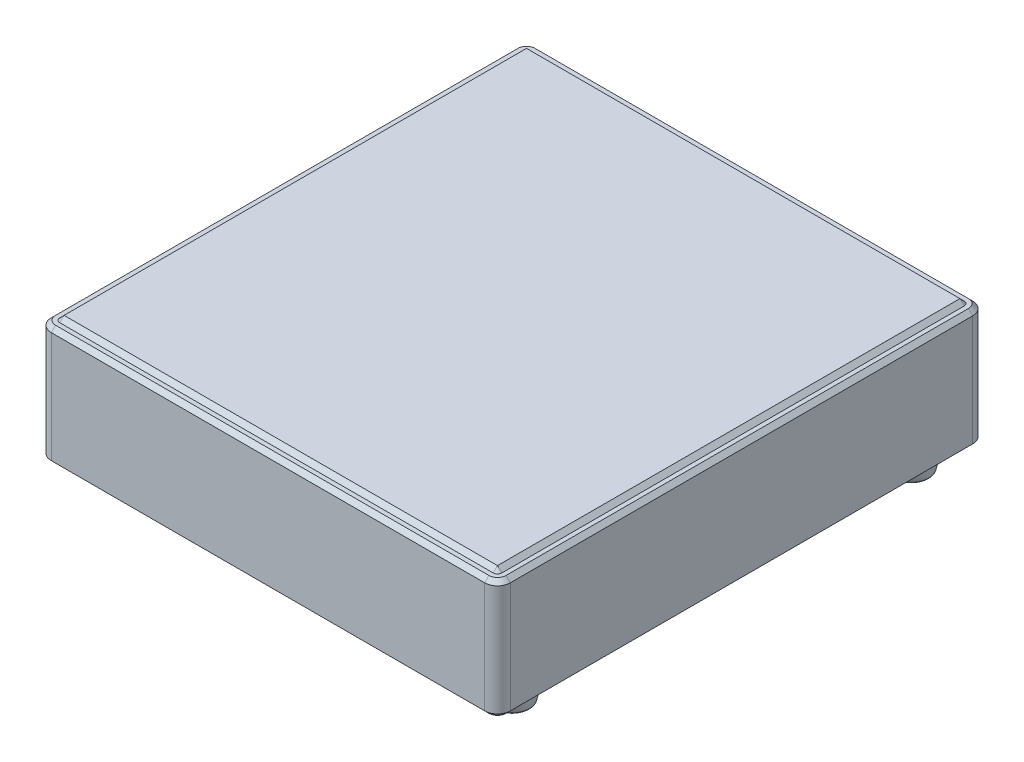
from build123d import *

# Parameters (mm, degrees)
SKETCH1_W                    = 107.6
SKETCH1_H                    = 114.4
BOSS_EXTRUDE1_DEPTH          = 30
SKETCH2_R                    = 1.5
CUT_EXTRUDE1_DEPTH           = 10
SKETCH3_R                    = 4.5
SKETCH3_R_2                  = 2.75
BOSS_EXTRUDE2_DEPTH          = 3
FILLET5_R                    = 0.5
FILLET5_OF_SKETCH_PATTERN1_R = 0.5
FILLET2_R                    = 3
SKETCH6_OUTSIDE_W            = 141.696
SKETCH6_OUTSIDE_H            = 148.496
CUT_EXTRUDE2_DEPTH           = 1
SKETCH7_OUTSIDE_W            = 141.696
SKETCH7_OUTSIDE_H            = 148.496
CUT_EXTRUDE3_DEPTH           = 1
CHAMFER1_SIZE                = 1
CHAMFER2_SIZE                = 1
FILLET4_R                    = 0.5


with BuildPart() as part:
    # Sketch1 → Boss-Extrude1 (new body)
    with BuildSketch(Plane(origin=(0, 0, 0), x_dir=(1, 0, 0), z_dir=(0, 1, 0))):
        with Locations((53.8, 57.2)):
            Rectangle(SKETCH1_W, SKETCH1_H)
    extrude(amount=BOSS_EXTRUDE1_DEPTH)

    # Sketch2 → Cut-Extrude1 (cut)
    with BuildSketch(Plane.XZ):
        with Locations(Location((7, -104, 0), (0, 0, 270))):
            Circle(SKETCH2_R)
        with Locations(Location((100.6, -104, 0), (0, 0, 270))):
            Circle(SKETCH2_R)
        with Locations(Location((100.6, -10.4, 0), (0, 0, 270))):
            Circle(SKETCH2_R)
        with Locations(Location((7, -10.4, 0), (0, 0, 270))):
            Circle(SKETCH2_R)
        with Locations(Location((53.8, -17.2, 0), (0, 0, 270))):
            Circle(SKETCH2_R)
        with Locations(Location((53.8, -97.2, 0), (0, 0, 270))):
            Circle(SKETCH2_R)
    extrude(amount=-CUT_EXTRUDE1_DEPTH, mode=Mode.SUBTRACT)

    # Sketch3 → Boss-Extrude2 (add)
    with BuildSketch(Plane.XZ):
        with Locations(Location((7, -104, 0), (0, 0, 270))):
            Circle(SKETCH3_R)
        with Locations(Location((7, -104, 0), (0, 0, 270))):
            Circle(SKETCH3_R_2, mode=Mode.SUBTRACT)
    boss_extrude2 = extrude(amount=BOSS_EXTRUDE2_DEPTH)

    # Sketch8 → Cut-Revolve1 (revolve, cut)
    with BuildSketch(Plane(origin=(7, 0, 0), x_dir=(0, 0, -1), z_dir=(1, 0, 0))):
        with BuildLine():
            Line((108.5, 0), (108.5, -3))
            Line((108.5, -3), (108, -3))
            ThreePointArc((108, -3), (108.374143795, -1.520690633), (108.5, 0))
        make_face()
    cut_revolve1 = revolve(axis=Axis((7, -3, -104), (0, 1, 0)), mode=Mode.SUBTRACT)

    # Fillet5
    fillet5_edges = [part.edges().sort_by_distance(p)[0] for p in [
        (7, -3, -100),
    ]]
    fillet(fillet5_edges, radius=FILLET5_R)

    # Sketch-Pattern1: Boss-Extrude2, Cut-Revolve1 at 3 more places
    with Locations((0, 0, 93.6), (93.6, 0, 93.6), (93.6, 0, 0)):
        add(boss_extrude2)
        add(cut_revolve1, mode=Mode.SUBTRACT)

    # Fillet5 of Sketch-Pattern1
    fillet5_of_sketch_pattern1_edges = [part.edges().sort_by_distance(p)[0] for p in [
        (7, -3, -6.4),
        (100.6, -3, -6.4),
        (100.6, -3, -100),
    ]]
    fillet(fillet5_of_sketch_pattern1_edges, radius=FILLET5_OF_SKETCH_PATTERN1_R)

    # Fillet2
    fillet2_edges = [part.edges().sort_by_distance(p)[0] for p in [
        (0, 15, -114.4),
        (107.6, 15, -114.4),
        (107.6, 15, 0),
        (0, 15, 0),
    ]]
    fillet(fillet2_edges, radius=FILLET2_R)

    # Sketch6 outside → Cut-Extrude2 (cut)
    with BuildSketch(Plane(origin=(0, 30, 0), x_dir=(1, 0, 0), z_dir=(0, 1, 0))):
        with Locations((53.8, 57.2)):
            Rectangle(SKETCH6_OUTSIDE_W, SKETCH6_OUTSIDE_H)
        with BuildLine():
            Line((2, 111.4), (2, 3))
            ThreePointArc((2, 3), (2.292893219, 2.292893219), (3, 2))
            Line((3, 2), (104.6, 2))
            ThreePointArc((104.6, 2), (105.307106781, 2.292893219), (105.6, 3))
            Line((105.6, 3), (105.6, 111.4))
            ThreePointArc((105.6, 111.4), (105.307106781, 112.107106781), (104.6, 112.4))
            Line((104.6, 112.4), (3, 112.4))
            ThreePointArc((3, 112.4), (2.292893219, 112.107106781), (2, 111.4))
        make_face(mode=Mode.SUBTRACT)
    extrude(amount=-CUT_EXTRUDE2_DEPTH, mode=Mode.SUBTRACT)

    # Sketch7 outside → Cut-Extrude3 (cut)
    with BuildSketch(Plane.XZ):
        with Locations((53.8, -57.2)):
            Rectangle(SKETCH7_OUTSIDE_W, SKETCH7_OUTSIDE_H)
        with BuildLine():
            Line((105.6, -111.4), (105.6, -3))
            ThreePointArc((105.6, -3), (105.307106781, -2.292893219), (104.6, -2))
            Line((104.6, -2), (3, -2))
            ThreePointArc((3, -2), (2.292893219, -2.292893219), (2, -3))
            Line((2, -3), (2, -111.4))
            ThreePointArc((2, -111.4), (2.292893219, -112.107106781), (3, -112.4))
            Line((3, -112.4), (104.6, -112.4))
            ThreePointArc((104.6, -112.4), (105.307106781, -112.107106781), (105.6, -111.4))
        make_face(mode=Mode.SUBTRACT)
    extrude(amount=-CUT_EXTRUDE3_DEPTH, mode=Mode.SUBTRACT)

    # Chamfer1
    chamfer1_edges = [part.edges().sort_by_distance(p)[0] for p in [
        (0.878679656, 29, -0.878679656),
        (53.8, 29, -114.4),
        (0, 29, -57.2),
        (53.8, 29, 0),
        (107.6, 29, -57.2),
        (106.721320344, 29, -113.521320344),
        (106.721320344, 29, -0.878679656),
        (0.878679656, 29, -113.521320344),
        (0.878679656, 1, -0.878679656),
        (107.6, 1, -57.2),
        (53.8, 1, 0),
        (0, 1, -57.2),
        (53.8, 1, -114.4),
        (106.721320344, 1, -113.521320344),
        (0.878679656, 1, -113.521320344),
        (106.721320344, 1, -0.878679656),
    ]]
    chamfer(chamfer1_edges, length=CHAMFER1_SIZE)

    # Chamfer2
    chamfer2_edges = [part.edges().sort_by_distance(p)[0] for p in [
        (53.8, 30, -112.4),
        (2.292893219, 30, -112.107106781),
        (105.307106781, 30, -112.107106781),
        (2, 30, -57.2),
        (105.6, 30, -57.2),
        (2.292893219, 30, -2.292893219),
        (105.307106781, 30, -2.292893219),
        (53.8, 30, -2),
    ]]
    chamfer(chamfer2_edges, length=CHAMFER2_SIZE - 0.0001)  # a hair under: the kernel refuses the full size

    # Fillet4
    fillet4_edges = [part.edges().sort_by_distance(p)[0] for p in [
        (105.307106781, 0, -2.292893219),
        (105.6, 0, -57.2),
        (105.307106781, 0, -112.107106781),
        (53.8, 0, -112.4),
        (2.292893219, 0, -112.107106781),
        (2, 0, -57.2),
        (2.292893219, 0, -2.292893219),
        (53.8, 0, -2),
    ]]
    fillet(fillet4_edges, radius=FILLET4_R - 0.0001)  # a hair under: the kernel refuses the full size


solid = part.part
